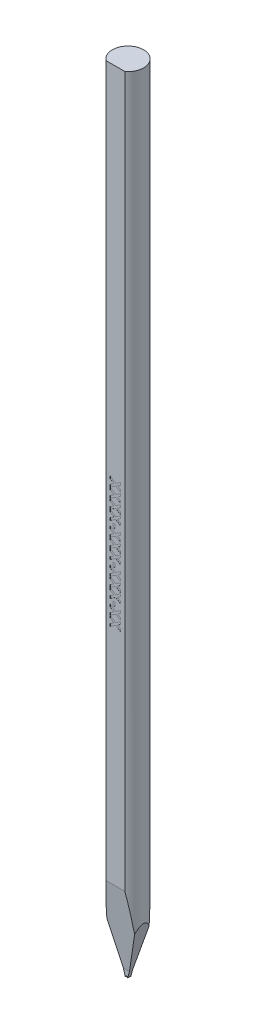
from build123d import *

# Parameters (mm, degrees)
SKETCH_TL_CUTTING_R       = 1.4986
TL_CUTTING_DEPTH          = 75.9968
SKETCH_TDF_GRINDING_W     = 3.0172
SKETCH_TDF_GRINDING_H     = 3.0172
TDF_GRINDING_DEPTH        = 77.026345527
SKETCH_ENGRAVING_W        = 0.166666667
SKETCH_ENGRAVING_H        = 0.371794872
ENGRAVING_DEPTH           = 0.005
VW_VR_GRINDING_DEPTH      = 1.5086
VW_VR_GRINDING_DEPTH_BACK = 1.5086
ISA_GRINDING_DEPTH        = 1.5086
ISA_GRINDING_DEPTH_BACK   = 1.5086
PRE_FRX_BRX_DEPTH         = 1.5086
PRE_FRX_BRX_DEPTH_BACK    = 1.5086
SKETCH_PRE_FRX_BRX_W      = 1.35874
SKETCH_PRE_FRX_BRX_H      = 0.6096
FR_EDM_R                  = 0.0381
BR_EDM_R                  = 0.0381
FA_BA_GRINDING_DEPTH      = 1.5086
FA_BA_GRINDING_DEPTH_BACK = 1.5086


with BuildPart() as part:
    # sketch_TL_cutting → TL_cutting (new body)
    with BuildSketch(Plane(origin=(0, 0, 0), x_dir=(1, 0, 0), z_dir=(0, 1, 0))):
        Circle(SKETCH_TL_CUTTING_R)
    extrude(amount=TL_CUTTING_DEPTH)

    # sketch_TDF_grinding → TDF_grinding (cut, through all)
    with BuildSketch(Plane(origin=(0, 0, 0), x_dir=(1, 0, 0), z_dir=(0, 1, 0))):
        with Locations((0, -2.71002)):
            Rectangle(SKETCH_TDF_GRINDING_W, SKETCH_TDF_GRINDING_H)
    extrude(amount=TDF_GRINDING_DEPTH, mode=Mode.SUBTRACT)

    # sketch_engraving → engraving (cut)
    with BuildSketch(Plane.XY.offset(1.20142)):
        Polygon((-0.5, 41.791829744), (0.029647436, 41.449081346), (0.5, 41.753368205), (0.5, 41.52860859), (0.203325321, 41.336701538), (0.5, 41.144794487), (0.5, 40.920034872), (0.029647436, 41.224321731), (-0.5, 40.881573333), (-0.5, 41.106332949), (-0.144030449, 41.336701538), (-0.5, 41.567070128), align=None)
        Polygon((-0.5, 40.868752821), (0.029647436, 40.526004423), (0.5, 40.830291282), (0.5, 40.605531667), (0.203325321, 40.413624615), (0.5, 40.221717564), (0.5, 39.996957949), (0.029647436, 40.301244808), (-0.5, 39.95849641), (-0.5, 40.183256026), (-0.144030449, 40.413624615), (-0.5, 40.643993205), align=None)
        Polygon((-0.5, 39.945675897), (0.029647436, 39.6029275), (0.5, 39.907214359), (0.5, 39.682454744), (0.203325321, 39.490547692), (0.5, 39.298640641), (0.5, 39.073881026), (0.029647436, 39.378167885), (-0.5, 39.035419487), (-0.5, 39.260179103), (-0.144030449, 39.490547692), (-0.5, 39.720916282), align=None)
        Polygon((-0.5, 39.022598974), (0.029647436, 38.679850577), (0.5, 38.984137436), (0.5, 38.759377821), (0.203325321, 38.567470769), (0.5, 38.375563718), (0.5, 38.150804103), (0.029647436, 38.455090962), (-0.5, 38.112342564), (-0.5, 38.337102179), (-0.144030449, 38.567470769), (-0.5, 38.797839359), align=None)
        with Locations((-0.147435898, 37.843111795)):
            Rectangle(SKETCH_ENGRAVING_W, SKETCH_ENGRAVING_H)
        Polygon((-0.5, 37.63798359), (0.029647436, 37.295235192), (0.5, 37.599522051), (0.5, 37.374762436), (0.203325321, 37.182855385), (0.5, 36.990948333), (0.5, 36.766188718), (0.029647436, 37.070475577), (-0.5, 36.727727179), (-0.5, 36.952486795), (-0.144030449, 37.182855385), (-0.5, 37.413223974), align=None)
        Polygon((-0.5, 36.714906667), (0.029647436, 36.372158269), (0.5, 36.676445128), (0.5, 36.451685513), (0.203325321, 36.259778462), (0.5, 36.06787141), (0.5, 35.843111795), (0.029647436, 36.147398654), (-0.5, 35.804650256), (-0.5, 36.029409872), (-0.144030449, 36.259778462), (-0.5, 36.490147051), align=None)
        Polygon((-0.5, 35.791829744), (0.029647436, 35.449081346), (0.5, 35.753368205), (0.5, 35.52860859), (0.203325321, 35.336701538), (0.5, 35.144794487), (0.5, 34.920034872), (0.029647436, 35.224321731), (-0.5, 34.881573333), (-0.5, 35.106332949), (-0.144030449, 35.336701538), (-0.5, 35.567070128), align=None)
        with Locations((-0.147435898, 34.612342564)):
            Rectangle(SKETCH_ENGRAVING_W, SKETCH_ENGRAVING_H)
        Polygon((-0.5, 34.407214359), (0.029647436, 34.064465962), (0.5, 34.368752821), (0.5, 34.143993205), (0.203325321, 33.952086154), (0.5, 33.760179103), (0.5, 33.535419487), (0.029647436, 33.839706346), (-0.5, 33.496957949), (-0.5, 33.721717564), (-0.144030449, 33.952086154), (-0.5, 34.182454744), align=None)
        Polygon((-0.5, 33.484137436), (0.029647436, 33.141389038), (0.5, 33.445675897), (0.5, 33.220916282), (0.203325321, 33.029009231), (0.5, 32.837102179), (0.5, 32.612342564), (0.029647436, 32.916629423), (-0.5, 32.573881026), (-0.5, 32.798640641), (-0.144030449, 33.029009231), (-0.5, 33.259377821), align=None)
        Polygon((-0.5, 32.561060513), (0.029647436, 32.218312115), (0.5, 32.522598974), (0.5, 32.297839359), (0.203325321, 32.105932308), (0.5, 31.914025256), (0.5, 31.689265641), (0.029647436, 31.9935525), (-0.5, 31.650804103), (-0.5, 31.875563718), (-0.144030449, 32.105932308), (-0.5, 32.336300897), align=None)
        with Locations((-0.147435898, 31.381573333)):
            Rectangle(SKETCH_ENGRAVING_W, SKETCH_ENGRAVING_H)
        Polygon((-0.5, 31.176445128), (0.029647436, 30.833696731), (0.5, 31.13798359), (0.5, 30.913223974), (0.203325321, 30.721316923), (0.5, 30.529409872), (0.5, 30.304650256), (0.029647436, 30.608937115), (-0.5, 30.266188718), (-0.5, 30.490948333), (-0.144030449, 30.721316923), (-0.5, 30.951685513), align=None)
        Polygon((-0.5, 30.253368205), (0.029647436, 29.910619808), (0.5, 30.214906667), (0.5, 29.990147051), (0.203325321, 29.79824), (0.5, 29.606332949), (0.5, 29.381573333), (0.029647436, 29.685860192), (-0.5, 29.343111795), (-0.5, 29.56787141), (-0.144030449, 29.79824), (-0.5, 30.02860859), align=None)
    extrude(amount=-ENGRAVING_DEPTH, mode=Mode.SUBTRACT)

    # sketch_VW_VR_grinding → VW_VR_grinding (cut, two sides: drawn at the far end of the back side and taken through both)
    with BuildSketch(Plane.XY.offset(-VW_VR_GRINDING_DEPTH_BACK)):
        with BuildLine():
            Line((-1.4936, -0.01), (-1.4936, 0.5946))
            ThreePointArc((-1.4936, 0.5946), (-1.495064466, 0.598135534), (-1.4986, 0.5996))
            Line((-1.4986, 0.5996), (-1.5086, 0.5996))
            Line((-1.5086, 0.5996), (-1.5086, -0.01))
            Line((-1.5086, -0.01), (-1.4936, -0.01))
        make_face()
        with BuildLine():
            Line((1.4936, -0.01), (1.4936, 0.5946))
            ThreePointArc((1.4936, 0.5946), (1.495064466, 0.598135534), (1.4986, 0.5996))
            Line((1.4986, 0.5996), (1.5086, 0.5996))
            Line((1.5086, 0.5996), (1.5086, -0.01))
            Line((1.5086, -0.01), (1.4936, -0.01))
        make_face()
    extrude(amount=VW_VR_GRINDING_DEPTH + VW_VR_GRINDING_DEPTH_BACK, mode=Mode.SUBTRACT)

    # sketch_ISA_grinding → ISA_grinding (cut, two sides: drawn at the far end of the back side and taken through both)
    with BuildSketch(Plane.XY.offset(-ISA_GRINDING_DEPTH_BACK)):
        Polygon((-0.12446, 0), (-1.5086, 5.165680805), (-1.5086, -0.01), (1.5086, -0.01), (1.5086, 5.165680805), (0.12446, 0), align=None)
    extrude(amount=ISA_GRINDING_DEPTH + ISA_GRINDING_DEPTH_BACK, mode=Mode.SUBTRACT)

    # sketch_pre_FRX_BRX → pre_FRX_BRX (cut, two sides: drawn at the far end of the back side and taken through both)
    with BuildSketch(Plane(origin=(0, 0, 0), x_dir=(0, 0, -1), z_dir=(1, 0, 0)).offset(-PRE_FRX_BRX_DEPTH_BACK)):
        with Locations((-0.82923, 0.2948)):
            Rectangle(SKETCH_PRE_FRX_BRX_W, SKETCH_PRE_FRX_BRX_H)
        with Locations((0.82923, 0.2948)):
            Rectangle(SKETCH_PRE_FRX_BRX_W, SKETCH_PRE_FRX_BRX_H)
    extrude(amount=PRE_FRX_BRX_DEPTH + PRE_FRX_BRX_DEPTH_BACK, mode=Mode.SUBTRACT)

    # V-Groove_EDM: sweep along a path in sketch_contour_V-Groove
    with BuildLine(Plane(origin=(0, 0, 0), x_dir=(0, 0, -1), z_dir=(1, 0, 0))) as v_groove_edm_path:
        Line((-1.20142, 0.07874), (0, 0.07874))
        Line((0, 0.07874), (1.4986, 0.07874))
    # sketch_section_V-Groove → V-Groove_EDM (sweep, cut)
    with BuildSketch(Plane.XY.offset(1.20142)):
        with BuildLine():
            Line((-0.619923416, -0.7874), (-0.021157771, 0.067725961))
            ThreePointArc((-0.021157771, 0.067725961), (0, 0.07874), (0.021157771, 0.067725961))
            Line((0.021157771, 0.067725961), (0.619923416, -0.7874))
            Line((0.619923416, -0.7874), (-0.619923416, -0.7874))
        make_face()
    sweep(path=v_groove_edm_path.line, mode=Mode.SUBTRACT)

    # FR_EDM
    fr_edm_edges = [part.edges().sort_by_distance(p)[0] for p in [
        (0.044868886, 0.033862981, 0.14986),
        (0, 0.07874, 0.14986),
        (-0.044868886, 0.033862981, 0.14986),
    ]]
    fillet(fr_edm_edges, radius=FR_EDM_R)

    # BR_EDM
    br_edm_edges = [part.edges().sort_by_distance(p)[0] for p in [
        (0.044868886, 0.033862981, -0.14986),
        (0, 0.07874, -0.14986),
        (-0.044868886, 0.033862981, -0.14986),
    ]]
    fillet(br_edm_edges, radius=BR_EDM_R)

    # sketch_FA_BA_grinding → FA_BA_grinding (cut, two sides: drawn at the far end of the back side and taken through both)
    with BuildSketch(Plane(origin=(0, 0, 0), x_dir=(0, 0, -1), z_dir=(1, 0, 0)).offset(-FA_BA_GRINDING_DEPTH_BACK)):
        Polygon((2.4986, 17.321753482), (2.4986, -0.1), (0.14986, -0.1), (0.14986, 0.6096), align=None)
        Polygon((-3.097568656, 21.583636919), (-0.14986, 0.6096), (-0.14986, -0.1), (-3.097568656, -0.1), align=None)
    extrude(amount=FA_BA_GRINDING_DEPTH + FA_BA_GRINDING_DEPTH_BACK, mode=Mode.SUBTRACT)


solid = part.part
